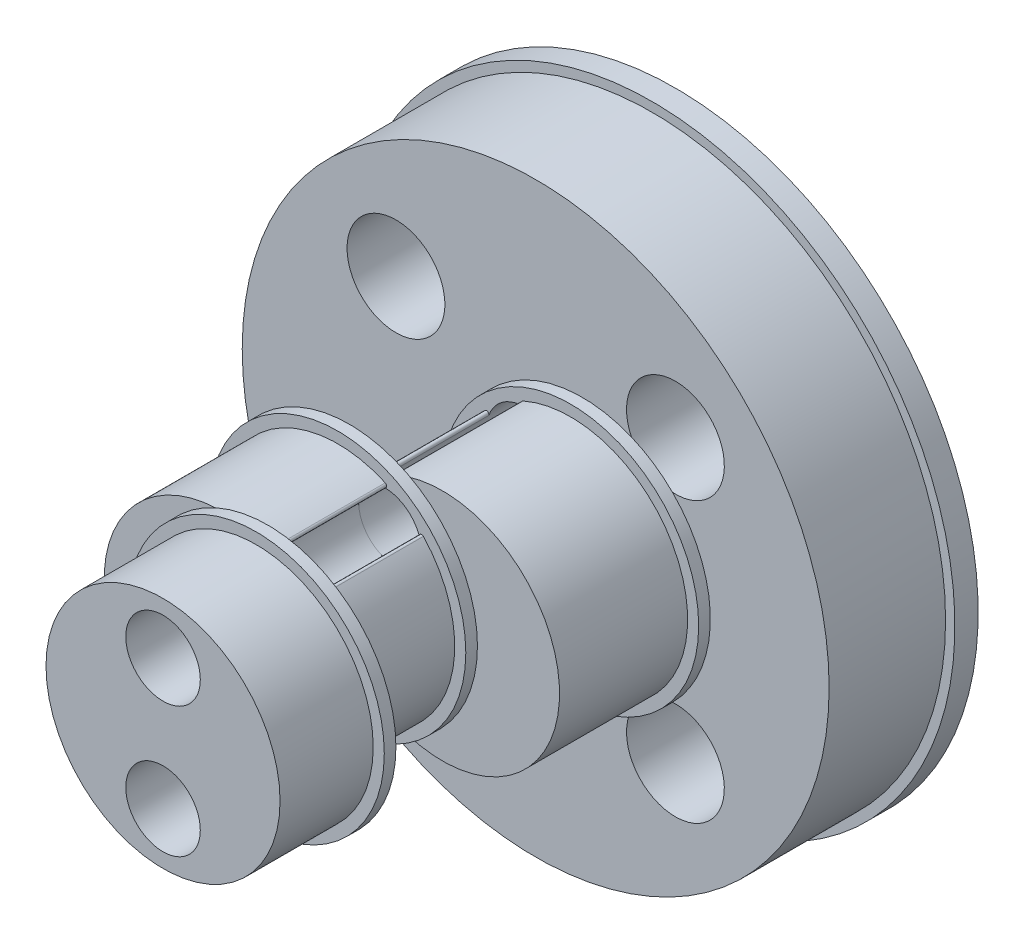
from build123d import *

# Parameters (mm, degrees)
SKETCH1_R               = 12.6
BOSS_EXTRUDE1_DEPTH     = 5
SKETCH2_R               = 5.499454457575955
SKETCH2_R_2             = 5.0249999999999995
BOSS_EXTRUDE2_DEPTH     = 0.5
BOSS_EXTRUDE3_START     = 3
BOSS_EXTRUDE3_OUTLINE_R = 5.025
BOSS_EXTRUDE3_DEPTH     = 6
BOSS_EXTRUDE4_START     = 6
SKETCH3_R               = 5.5
SKETCH3_R_2             = 5.0249999999999995
BOSS_EXTRUDE4_DEPTH     = 0.5
BOSS_EXTRUDE5_START     = 6
SKETCH3_3_R             = 5.0249999999999995
BOSS_EXTRUDE5_DEPTH     = 5.5
BOSS_EXTRUDE6_START     = 11.5
SKETCH4_R               = 5.5
SKETCH4_R_2             = 5.0249999999999995
BOSS_EXTRUDE6_DEPTH     = 0.5
BOSS_EXTRUDE7_START     = 11.5
SKETCH4_7_R             = 5.0249999999999995
BOSS_EXTRUDE7_DEPTH     = 4.5
SKETCH5_R               = 1.6000000000000003
CUT_EXTRUDE1_DEPTH      = 28.541241802068402
SPLIT1_START            = 9
SPLIT1_OUTLINE_R        = 1.6
SPLIT1_DEPTH            = 10
SPLIT1_2_DEPTH          = 5.5
SPLIT1_3_OUTLINE_R      = 5.5
SPLIT1_3_DEPTH          = 0.5
SPLIT1_START_2          = 14.5
SPLIT1_4_OUTLINE_R      = 5.025
SPLIT1_4_OUTLINE_R_2    = 1.6
SPLIT1_4_DEPTH          = 4.5
SPLIT1_5_OUTLINE_R      = 5.5
SPLIT1_5_OUTLINE_R_2    = 5.025
SPLIT1_5_DEPTH          = 0.5
FILLET1_R               = 0.1
FILLET2_R               = 0.1
CUT_EXTRUDE2_DEPTH      = 3.2
SKETCH7_R               = 2.1000000000000005
SKETCH7_R_2             = 2.099999999999999
SKETCH7_R_3             = 2.1000000000000014
CUT_EXTRUDE3_DEPTH      = 5
SKETCH8_R               = 13
SKETCH8_R_2             = 12.600000000000003
BOSS_EXTRUDE8_DEPTH     = 1


# Read off the part's stored shape, not the designer's step: Boss-Extrude3, Split1
with BuildPart() as part:
    # Sketch1 → Boss-Extrude1 (new body)
    with BuildSketch(Plane(origin=(0, 0, -2), x_dir=(-1, 0, 0), z_dir=(0, 0, -1))):
        Circle(SKETCH1_R)
    extrude(amount=-BOSS_EXTRUDE1_DEPTH)

    # Sketch2 → Boss-Extrude2 (add)
    with BuildSketch(Plane.XY.offset(3)):
        with Locations(Location((2, 0, 0), (0, 0, 180))):
            Circle(SKETCH2_R)
        with Locations((2, 0)):
            Circle(SKETCH2_R_2, mode=Mode.SUBTRACT)
    extrude(amount=BOSS_EXTRUDE2_DEPTH)

    # Boss-Extrude3 outline → Boss-Extrude3 (add)
    with BuildSketch(Plane.XY.offset(BOSS_EXTRUDE3_START)):
        with Locations((2, 0)):
            Circle(BOSS_EXTRUDE3_OUTLINE_R)
    extrude(amount=BOSS_EXTRUDE3_DEPTH)



with BuildPart() as body_2:
    # Sketch3 → Boss-Extrude4 (new body)
    with BuildSketch(Plane.XY.offset(3).offset(BOSS_EXTRUDE4_START)):
        with Locations((-2, -2.4e-16)):
            Circle(SKETCH3_R)
        with Locations((-2, -2.4e-16)):
            Circle(SKETCH3_R_2, mode=Mode.SUBTRACT)
    extrude(amount=BOSS_EXTRUDE4_DEPTH)


with BuildPart() as part_1:
    add(part.part)

    add(body_2.part)  # Boss-Extrude5 merges body 2
    # Sketch3<3> → Boss-Extrude5 (add)
    with BuildSketch(Plane.XY.offset(3).offset(BOSS_EXTRUDE5_START)):
        with Locations((-2, -2.4e-16)):
            Circle(SKETCH3_3_R)
    extrude(amount=BOSS_EXTRUDE5_DEPTH)

    # Sketch4 → Boss-Extrude6 (add)
    with BuildSketch(Plane.XY.offset(3).offset(BOSS_EXTRUDE6_START)):
        with Locations(Location((0, 0, 0), (0, 0, 114.145956113))):
            Circle(SKETCH4_R)
        with Locations(Location((0, 0, 0), (0, 0, 101.478778724))):
            Circle(SKETCH4_R_2, mode=Mode.SUBTRACT)
    extrude(amount=BOSS_EXTRUDE6_DEPTH)

    # Sketch4<7> → Boss-Extrude7 (add)
    with BuildSketch(Plane.XY.offset(3).offset(BOSS_EXTRUDE7_START)):
        Circle(SKETCH4_7_R)
    extrude(amount=BOSS_EXTRUDE7_DEPTH)

    # Sketch5 → Cut-Extrude1 (cut, through all)
    with BuildSketch(Plane.XY.offset(19)):
        with Locations((2e-17, 2.8)):
            Circle(SKETCH5_R)
        with Locations((7.1e-16, -2.8)):
            Circle(SKETCH5_R)
    extrude(amount=-CUT_EXTRUDE1_DEPTH, mode=Mode.SUBTRACT)

    # Split1 outline → Split1 (cut)
    with BuildSketch(Plane.XY.offset(SPLIT1_START)):
        with BuildLine():
            ThreePointArc((-1, 5.408326913), (-7.5, 0), (-1, -5.408326913))
            ThreePointArc((-1, -5.408326913), (5.5, 0), (-1, 5.408326913))
        make_face()
        with Locations((0, 2.8)):
            Circle(SPLIT1_OUTLINE_R, mode=Mode.SUBTRACT)
        with Locations((0, -2.8)):
            Circle(SPLIT1_OUTLINE_R, mode=Mode.SUBTRACT)
    extrude(amount=SPLIT1_DEPTH, mode=Mode.SUBTRACT)

    # Fillet2
    fillet2_edges = [part_1.edges().sort_by_distance(p)[0] for p in [
        (-0.6950501563685023, -4.241147209736785, 6.25),
        (-1.1378256882260929, -3.9248789726956494, 6.25),
        (-1.1378256882260933, 3.9248789726956486, 6.25),
        (-0.6950501563685028, 4.241147209736784, 6.25),
    ]]
    fillet(fillet2_edges, radius=FILLET2_R)

    # Sketch6 → Cut-Extrude2 (cut)
    with BuildSketch(Plane(origin=(0, 0, -2), x_dir=(-1, 0, 0), z_dir=(0, 0, -1))):
        with BuildLine():
            Line((2.8, 2.8), (2.799999999999999, -2.8))
            ThreePointArc((2.799999999999999, -2.8), (-1.22e-15, -5.6), (-2.8000000000000007, -2.8))
            Line((-2.8000000000000007, -2.8), (-2.8, 2.8))
            ThreePointArc((-2.8, 2.8), (1.5e-16, 5.6), (2.8, 2.8))
        make_face()
    extrude(amount=-CUT_EXTRUDE2_DEPTH, mode=Mode.SUBTRACT)

    # Sketch7 → Cut-Extrude3 (cut)
    with BuildSketch(Plane(origin=(0, 0, -2), x_dir=(-1, 0, 0), z_dir=(0, 0, -1))):
        with Locations((-6.000000000000002, 5.999999999999999)):
            Circle(SKETCH7_R)
        with Locations((5.999999999999998, 5.999999999999999)):
            Circle(SKETCH7_R)
        with Locations((5.999999999999998, -6.000000000000001)):
            Circle(SKETCH7_R_2)
        with Locations((-6.000000000000003, -6)):
            Circle(SKETCH7_R_3)
    extrude(amount=-CUT_EXTRUDE3_DEPTH, mode=Mode.SUBTRACT)


with BuildPart() as body_2_2:
    # Split1 2 outline → Split1 2 (new body)
    with BuildSketch(Plane.XY.offset(SPLIT1_START)):
        with BuildLine():
            ThreePointArc((1.137825688, -3.924878973), (3.025, 0), (1.137825688, 3.924878973))
            ThreePointArc((1.137825688, 3.924878973), (-0.92998111, 1.498026446), (0.695050156, 4.24114721))
            ThreePointArc((0.695050156, 4.24114721), (-7.025, 0), (0.695050156, -4.24114721))
            ThreePointArc((0.695050156, -4.24114721), (-0.92998111, -1.498026446), (1.137825688, -3.924878973))
        make_face()
    extrude(amount=SPLIT1_2_DEPTH)

    # Split1 3 outline → Split1 3 (add)
    with BuildSketch(Plane.XY.offset(SPLIT1_START)):
        with Locations((-2, 0)):
            Circle(SPLIT1_3_OUTLINE_R)
        with BuildLine():
            ThreePointArc((0.695050156, 4.24114721), (0.92998111, 4.101973554), (1.137825688, 3.924878973))
            ThreePointArc((1.137825688, 3.924878973), (3.025, 0), (1.137825688, -3.924878973))
            ThreePointArc((1.137825688, -3.924878973), (0.92998111, -4.101973554), (0.695050156, -4.24114721))
            ThreePointArc((0.695050156, -4.24114721), (-7.025, 0), (0.695050156, 4.24114721))
        make_face(mode=Mode.SUBTRACT)
    extrude(amount=SPLIT1_3_DEPTH)

    # Fillet1
    # the kernel refuses this fillet: 0.1 mm, written as the material it takes off along each edge
    with BuildSketch(Plane(origin=(1.1378256880000006, -3.924878973, 9.5), x_dir=(0.5272838464707954, 0.8496892050926401, 0), z_dir=(0, 0, 1))) as fillet1_piece_1:
        with BuildLine():
            CenterArc((0.7339208558356513, -0.09749554475196075), FILLET1_R, 102.8500510005881, 156.06997269077794)
            Line((0.7147029545095785, -0.19563153340353207), (0.7143185964830571, -0.19759425317656348))
            ThreePointArc((0.7143185964830571, -0.19759425317656348), (0.3532125240431902, -0.1129366525704308), (-0.00066881691387395, -0.00188485647615828))
            Line((-0.00066881691387395, -0.00188485647615828), (0.00044480051866812, 0.00194991089503923))
            ThreePointArc((0.00044480051866812, 0.00194991089503923), (0.35584041495112406, -0.03807128397050696), (0.7112360293835808, 0.00194991089503922))
            Line((0.7112360293835808, 0.00194991089503922), (0.7116808299022489, -4e-17))
        make_face()
    extrude(amount=5, mode=Mode.SUBTRACT)
    with BuildSketch(Plane(origin=(0.6950501559999995, -4.241147210000001, 9.5), x_dir=(-0.9747710361649122, -0.22320713934366773, 0), z_dir=(0, 0, 1))) as fillet1_piece_2:
        with BuildLine():
            CenterArc((0.7339208553218103, 0.09749554475551281), FILLET1_R, 101.07997632228573, 156.06997268627677)
            Line((0.714702953972355, 0.19563153340250483), (0.7143185959453658, 0.1975942531754444))
            ThreePointArc((0.7143185959453658, 0.1975942531754444), (0.35321252377659246, 0.11293665255128191), (-0.00066881691414123, 0.00188485647606383))
            Line((-0.00066881691414123, 0.00188485647606383), (0.00044480051835665, -0.00194991089511022))
            ThreePointArc((0.00044480051835665, -0.00194991089511022), (0.35584041470198946, 0.03807128391367618), (0.711236028885622, -0.00194991089511051))
            Line((0.711236028885622, -0.00194991089511051), (0.7116808294039787, 0))
        make_face()
    extrude(amount=5, mode=Mode.SUBTRACT)
    with BuildSketch(Plane(origin=(0.6950501560000002, 4.24114721, 9.5), x_dir=(-0.8812560463152725, 0.4726391655721877, 0), z_dir=(0, 0, 1))) as fillet1_piece_3:
        with BuildLine():
            CenterArc((0.7336208593975166, 0.09972781848774585), FILLET1_R, 118.15832442623193, 156.06997268627686)
            Line((0.6864298993019216, 0.18789251258496353), (0.6854860801000094, 0.1896558064669081))
            ThreePointArc((0.6854860801000094, 0.1896558064669081), (0.35326623794808576, 0.05722576797323723), (-8.578182782469e-05, 0.00199815952266453))
            Line((-8.578182782469e-05, 0.00199815952266453), (-0.00014746147927519, -0.00199455636975523))
            ThreePointArc((-0.00014746147927519, -0.00199455636975523), (0.37049696668064286, -0.01567712099081798), (0.7411413948405625, -0.00199455636975463))
            Line((0.7411413948405625, -0.00199455636975463), (0.7409939333612872, 0))
        make_face()
    extrude(amount=5, mode=Mode.SUBTRACT)
    with BuildSketch(Plane(origin=(1.1378256880000008, 3.924878973, 9.5), x_dir=(0.7329038743989365, -0.6803322062720741, 0), z_dir=(0, 0, 1))) as fillet1_piece_4:
        with BuildLine():
            CenterArc((0.7336208599111411, -0.09972781848739057), FILLET1_R, 85.77170288473079, 156.06997269077783)
            Line((0.6864298998182243, -0.1878925125860417), (0.6854860806163661, -0.18965580646801475))
            ThreePointArc((0.6854860806163661, -0.18965580646801475), (0.35326623821426095, -0.05722576791705115), (-8.578182712573e-05, -0.00199815952269459))
            Line((-8.578182712573e-05, -0.00199815952269459), (-0.00014746147937158, 0.00199455636974773))
            ThreePointArc((-0.00014746147937158, 0.00199455636974773), (0.3704969669398584, 0.01567712100932383), (0.7411413953590879, 0.00199455636974782))
            Line((0.7411413953590879, 0.00199455636974782), (0.7409939338797163, 3e-17))
        make_face()
    extrude(amount=5, mode=Mode.SUBTRACT)


with BuildPart() as body_3:
    # Split1 4 outline → Split1 4 (new body)
    with BuildSketch(Plane.XY.offset(SPLIT1_START_2)):
        Circle(SPLIT1_4_OUTLINE_R)
        with Locations((0, -2.8)):
            Circle(SPLIT1_4_OUTLINE_R_2, mode=Mode.SUBTRACT)
        with Locations((0, 2.8)):
            Circle(SPLIT1_4_OUTLINE_R_2, mode=Mode.SUBTRACT)
    extrude(amount=SPLIT1_4_DEPTH)

    # Split1 5 outline → Split1 5 (add)
    with BuildSketch(Plane.XY.offset(SPLIT1_START_2)):
        Circle(SPLIT1_5_OUTLINE_R)
        Circle(SPLIT1_5_OUTLINE_R_2, mode=Mode.SUBTRACT)
    extrude(amount=SPLIT1_5_DEPTH)


with BuildPart() as body_4:
    # Sketch8 → Boss-Extrude8 (new body)
    with BuildSketch(Plane(origin=(0, 0, -2), x_dir=(-1, 0, 0), z_dir=(0, 0, -1))):
        Circle(SKETCH8_R)
        Circle(SKETCH8_R_2, mode=Mode.SUBTRACT)
    extrude(amount=BOSS_EXTRUDE8_DEPTH)


solid = Compound([part_1.part, body_2_2.part, body_3.part, body_4.part])
